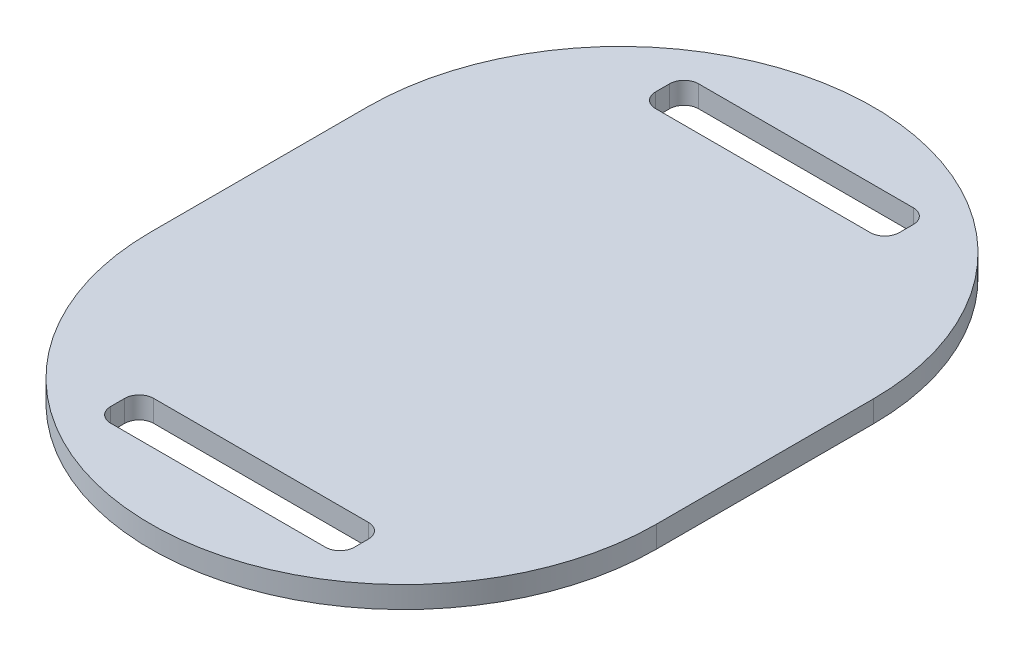
from build123d import *

# Parameters (mm, degrees)
BOSS_EXTRUDE1_DEPTH     = 7.62
CUT_EXTRUDE1_DEPTH      = 188.668016455
CUT_EXTRUDE1_DEPTH_BACK = 188.668016455
SKETCH2_W               = 85.677392152
SKETCH2_H               = 15.123471854
FILLET1_R               = 5.08


with BuildPart() as part:
    # Sketch1 → Boss-Extrude1 (new body)
    with BuildSketch(Plane(origin=(0, 0, 0), x_dir=(1, 0, 0), z_dir=(0, 1, 0))):
        with BuildLine():
            Line((-88.9, 0), (-88.9, 76.2))
            ThreePointArc((-88.9, 76.2), (0, 165.1), (88.9, 76.2))
            Line((88.9, 76.2), (88.9, 0))
            ThreePointArc((88.9, 0), (0, -88.9), (-88.9, 0))
        make_face()
    extrude(amount=BOSS_EXTRUDE1_DEPTH)

    # Sketch2 → Cut-Extrude1 (cut, two sides: drawn at the far end of the back side and taken through both)
    with BuildSketch(Plane(origin=(0, 7.62, 0), x_dir=(1, 0, 0), z_dir=(0, 1, 0)).offset(-CUT_EXTRUDE1_DEPTH_BACK)):
        with Locations((0, -57.668972336)):
            Rectangle(SKETCH2_W, SKETCH2_H)
        with Locations((0, 133.868972336)):
            Rectangle(SKETCH2_W, SKETCH2_H)
    extrude(amount=CUT_EXTRUDE1_DEPTH + CUT_EXTRUDE1_DEPTH_BACK, mode=Mode.SUBTRACT)

    # Fillet1
    fillet1_edges = [part.edges().sort_by_distance(p)[0] for p in [
        (-42.838696076, 3.81, -141.430708263),
        (-42.838696076, 3.81, -126.307236409),
        (42.838696076, 3.81, -141.430708263),
        (42.838696076, 3.81, -126.307236409),
        (42.838696076, 3.81, 50.107236409),
        (42.838696076, 3.81, 65.230708263),
        (-42.838696076, 3.81, 65.230708263),
        (-42.838696076, 3.81, 50.107236409),
    ]]
    fillet(fillet1_edges, radius=FILLET1_R)


solid = part.part
